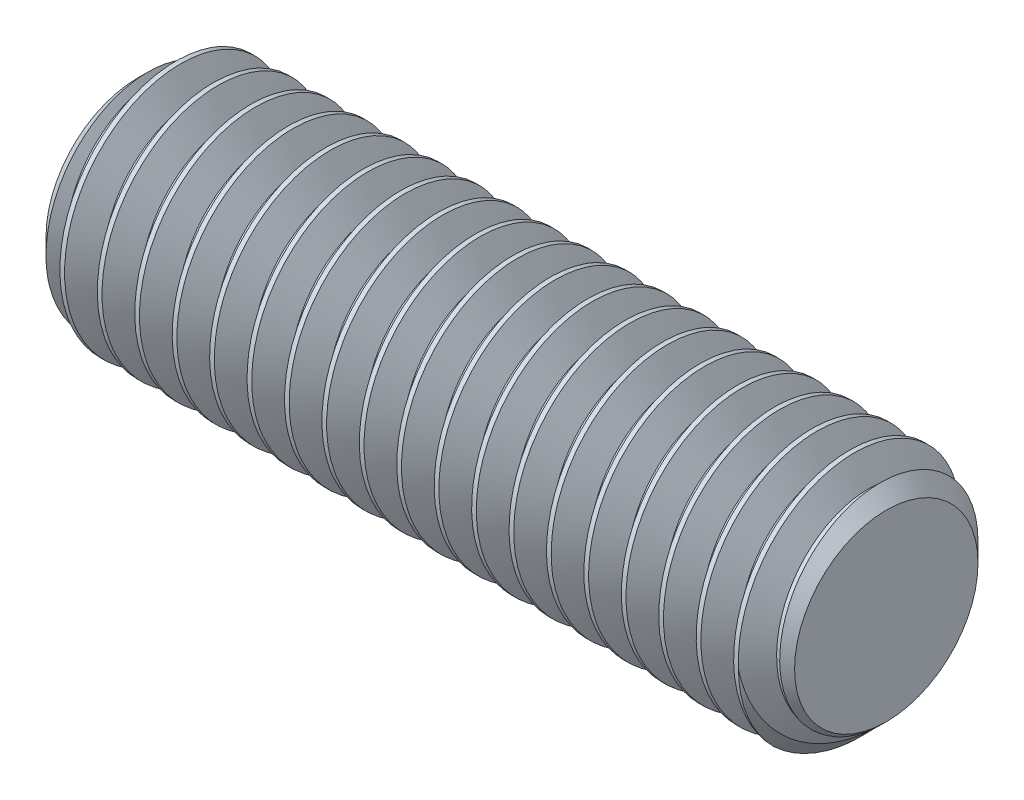
from build123d import *

# Parameters (mm, degrees)
BOSS_EXTRUDE1_DEPTH      = 12.5
BOSS_EXTRUDE1_DEPTH_BACK = 12.5
SKETCH2_R                = 4
CHAMFER1_SIZE            = 0.9375
CUT_SWEEP3_PITCH         = 1.25


with BuildPart() as part:
    # Sketch2 → Boss-Extrude1 (new, two sides: drawn at the far end of the back side and taken through both)
    with BuildSketch(Plane(origin=(0, 0, 0), x_dir=(0, 0, -1), z_dir=(1, 0, 0)).offset(-BOSS_EXTRUDE1_DEPTH_BACK)):
        Circle(SKETCH2_R)
    extrude(amount=BOSS_EXTRUDE1_DEPTH + BOSS_EXTRUDE1_DEPTH_BACK)

    # Chamfer1
    chamfer1_edges = [part.edges().sort_by_distance(p)[0] for p in [
        (-12.5, 0, 4),
        (12.5, 0, 4),
    ]]
    chamfer(chamfer1_edges, length=CHAMFER1_SIZE)

    # Cut-Sweep3: the profile of Sketch4 screwed along a right-hand helix of 21 turns, 8 arcs to a turn; built about Z, then put on its axis
    cut_sweep3_z = Axis((0, 0, 0), (0, 0, 1))
    cut_sweep3_corners = [(3.188101184, 0, -0.46875), (4.067658235, 0, 0.0390625), (4.067658235, 0, -1.1328125), (3.188101184, 0, -0.625)]
    with BuildLine(mode=Mode.PRIVATE) as cut_sweep3_profile:
        Line(cut_sweep3_corners[0], cut_sweep3_corners[1])
        Line(cut_sweep3_corners[1], cut_sweep3_corners[2])
        Line(cut_sweep3_corners[2], cut_sweep3_corners[3])
        Line(cut_sweep3_corners[3], cut_sweep3_corners[0])
    cut_sweep3_cap = Face(cut_sweep3_profile.wire())
    cut_sweep3_turn_angles = [0, 22.5, 45, 67.5, 90, 112.5, 135, 157.5, 180, 202.5, 225, 247.5, 270, 292.5, 315, 337.5, 360]
    cut_sweep3_turn_weights = [1, 0.9238795325112867, 1, 0.9238795325112867, 1, 0.9238795325112867, 1, 0.9238795325112867, 1, 0.9238795325112867, 1, 0.9238795325112867, 1, 0.9238795325112867, 1, 0.9238795325112867, 1]
    cut_sweep3_turn_rails = [Edge.make_bspline([Vector(p[0], p[1], 0).rotate(cut_sweep3_z, cut_sweep3_turn_angles[k]) / cut_sweep3_turn_weights[k] + Vector(0, 0, p[2] + CUT_SWEEP3_PITCH * cut_sweep3_turn_angles[k] / 360) for k in range(17)], [0, 0, 0, 1, 1, 2, 2, 3, 3, 4, 4, 5, 5, 6, 6, 7, 7, 8, 8, 8], 2, cut_sweep3_turn_weights) for p in cut_sweep3_corners]
    cut_sweep3_turn_sides = [Face.make_surface_from_curves(cut_sweep3_turn_rails[p[0]], cut_sweep3_turn_rails[p[1]]) for p in [(0, 1), (1, 2), (2, 3), (3, 0)]]
    cut_sweep3 = Plane(origin=(12.5, 0, 0), x_dir=(0, 1, 0), z_dir=(-1, 0, 0)) * Solid(Shell([*[p.moved(Location((0, 0, CUT_SWEEP3_PITCH * i))) for i in range(21) for p in cut_sweep3_turn_sides], cut_sweep3_cap, cut_sweep3_cap.rotate(cut_sweep3_z, 7560).moved(Location((0, 0, CUT_SWEEP3_PITCH * 7560 / 360)))]))
    add(cut_sweep3, mode=Mode.SUBTRACT)


solid = part.part
